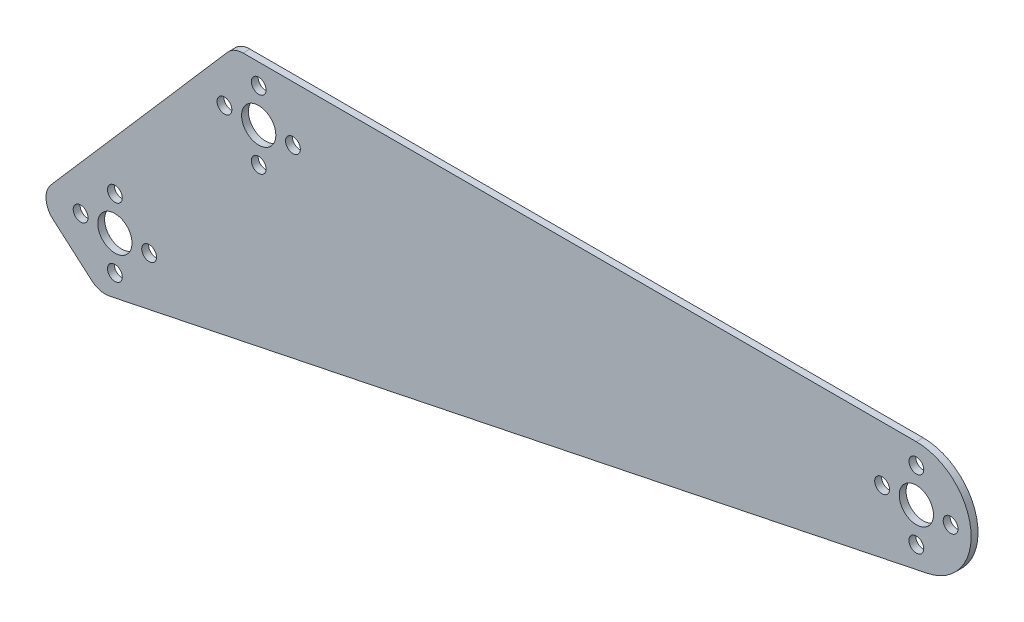
from build123d import *

# Parameters (mm, degrees)
SKETCH1_R           = 7.9375
SKETCH1_R_2         = 3.429
BOSS_EXTRUDE1_DEPTH = 3.175


with BuildPart() as part:
    # Sketch1 → Boss-Extrude1 (new body)
    with BuildSketch(Plane.XY):
        with BuildLine():
            Line((304.8, 25.4), (-7.234654307, 25.4))
            ThreePointArc((-7.234654307, 25.4), (-11.184607443, 24.542381105), (-14.423263058, 22.123962251))
            Line((-14.423263058, 22.123962251), (-96.240157768, -71.9956086))
            ThreePointArc((-96.240157768, -71.9956086), (-98.553346595, -78.909001264), (-95.300511268, -85.433179603))
            Line((-95.300511268, -85.433179603), (-77.389837916, -101.002690413))
            ThreePointArc((-77.389837916, -101.002690413), (-73.552808487, -103.028646494), (-69.21525712, -103.142405102))
            Line((-69.21525712, -103.142405102), (309.934982787, -24.875529176))
            ThreePointArc((309.934982787, -24.875529176), (330.068542113, 2.580848594), (304.8, 25.4))
        make_face()
        with Locations((304.8, 0)):
            Circle(SKETCH1_R, mode=Mode.SUBTRACT)
        Circle(SKETCH1_R, mode=Mode.SUBTRACT)
        with Locations((-66.655597345, -76.678493351)):
            Circle(SKETCH1_R, mode=Mode.SUBTRACT)
        with Locations((0, 15.875)):
            Circle(SKETCH1_R_2, mode=Mode.SUBTRACT)
        with Locations((0, -15.875)):
            Circle(SKETCH1_R_2, mode=Mode.SUBTRACT)
        with Locations((-15.875, 0)):
            Circle(SKETCH1_R_2, mode=Mode.SUBTRACT)
        with Locations((15.875, 0)):
            Circle(SKETCH1_R_2, mode=Mode.SUBTRACT)
        with Locations((-66.655597345, -60.803493351)):
            Circle(SKETCH1_R_2, mode=Mode.SUBTRACT)
        with Locations((-66.655597345, -92.553493351)):
            Circle(SKETCH1_R_2, mode=Mode.SUBTRACT)
        with Locations((-82.530597345, -76.678493351)):
            Circle(SKETCH1_R_2, mode=Mode.SUBTRACT)
        with Locations((-50.780597345, -76.678493351)):
            Circle(SKETCH1_R_2, mode=Mode.SUBTRACT)
        with Locations((304.8, 15.875)):
            Circle(SKETCH1_R_2, mode=Mode.SUBTRACT)
        with Locations((320.675, 0)):
            Circle(SKETCH1_R_2, mode=Mode.SUBTRACT)
        with Locations((304.8, -15.875)):
            Circle(SKETCH1_R_2, mode=Mode.SUBTRACT)
        with Locations((288.925, 0)):
            Circle(SKETCH1_R_2, mode=Mode.SUBTRACT)
    extrude(amount=BOSS_EXTRUDE1_DEPTH)


solid = part.part
